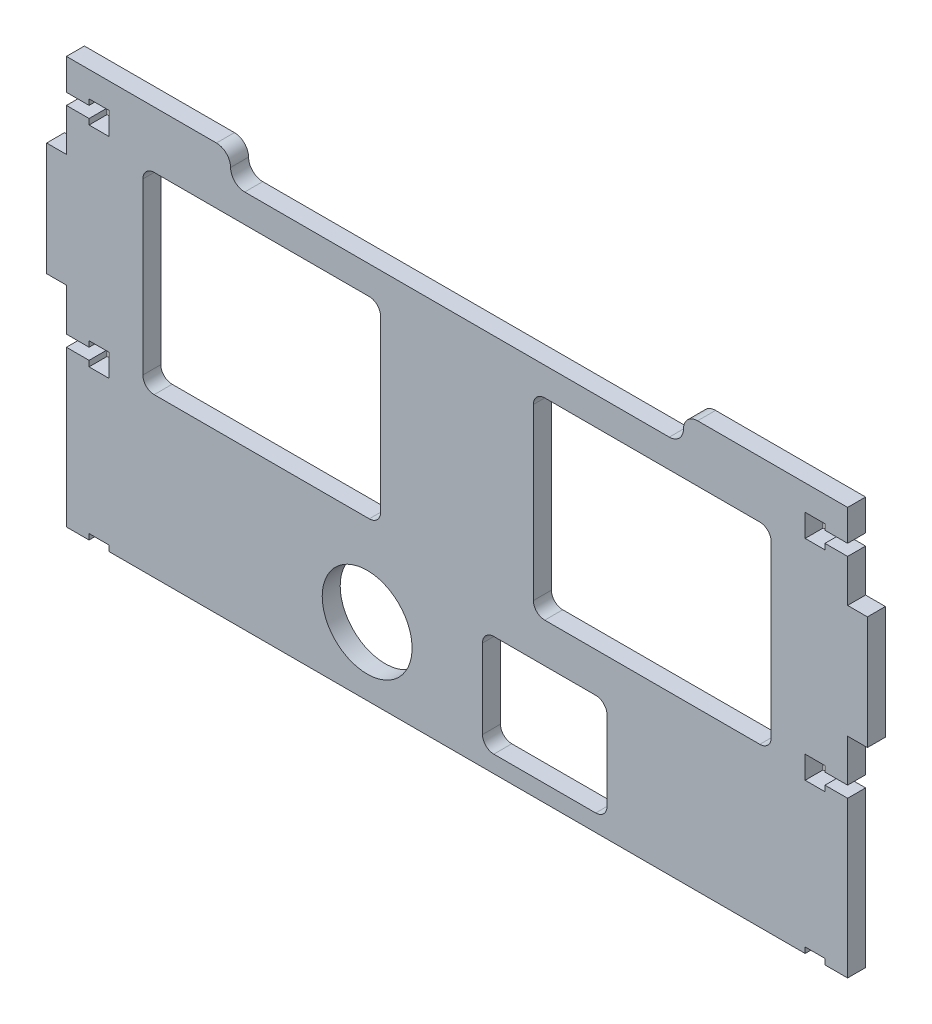
from build123d import *

# Parameters (mm, degrees)
BOSS_EXTRUDE1_DEPTH     = 3.175
CUT_EXTRUDE1_DEPTH      = 82.916607748
MIRROR2_COPY_1_DEPTH    = 82.916607748
SKETCH4_W               = 138
SKETCH4_H               = 9
BOSS_EXTRUDE3_DEPTH     = 3.175
CUT_EXTRUDE2_DEPTH      = 87.459994362
CUT_EXTRUDE2_DEPTH_BACK = 87.459994362
SKETCH5_W               = 80
SKETCH5_H               = 5
FILLET1_R               = 2.5
SKETCH6_W               = 3.5
SKETCH6_H               = 1
CUT_EXTRUDE3_DEPTH      = 87.459994362
SKETCH10_W              = 42
SKETCH10_H              = 34
CUT_EXTRUDE4_DEPTH      = 87.459994362
FILLET2_R               = 2
FILLET2_OF_MIRROR4_R    = 2
SKETCH11_R              = 7.9375
CUT_EXTRUDE5_DEPTH      = 10
SKETCH12_W              = 22
SKETCH12_H              = 18
CUT_EXTRUDE6_DEPTH      = 10
FILLET3_R               = 2


with BuildPart() as part:
    # Sketch1 → Boss-Extrude1 (new body)
    with BuildSketch(Plane.XY):
        Polygon((-69, -10), (-69, -38), (69, -38), (69, -10), (72.5, -10), (72.5, 10), (69, 10), (69, 25), (-69, 25), (-69, 10), (-72.5, 10), (-72.5, -10), align=None)
    extrude(amount=-BOSS_EXTRUDE1_DEPTH)

    # Sketch2 → Cut-Extrude1 (cut, symmetric)
    with BuildSketch(Plane.XY):
        Polygon((-69, 19.5), (-65, 19.5), (-65, 20.5), (-61.5, 20.5), (-61.5, 16.5), (-65, 16.5), (-65, 17.5), (-69, 17.5), align=None)
    cut_extrude1 = extrude(amount=CUT_EXTRUDE1_DEPTH, both=True, mode=Mode.SUBTRACT)

    # Mirror1: Cut-Extrude1 across plane
    add(cut_extrude1.mirror(Plane.ZY), mode=Mode.SUBTRACT)

    # Mirror2: Cut-Extrude1 across plane
    add(cut_extrude1.mirror(Plane.ZX), mode=Mode.SUBTRACT)

    # Mirror2 copy 1 sketch → Mirror2 copy 1 (cut, symmetric)
    with BuildSketch(Plane(origin=(0, 0, 0), x_dir=(-1, 0, 0), z_dir=(0, 0, 1))):
        Polygon((-69, 19.5), (-65, 19.5), (-65, 20.5), (-61.5, 20.5), (-61.5, 16.5), (-65, 16.5), (-65, 17.5), (-69, 17.5), align=None)
    extrude(amount=MIRROR2_COPY_1_DEPTH, both=True, mode=Mode.SUBTRACT)

    # Sketch4 → Boss-Extrude3 (add)
    with BuildSketch(Plane.XY):
        with Locations((0, -42.5)):
            Rectangle(SKETCH4_W, SKETCH4_H)
    extrude(amount=-BOSS_EXTRUDE3_DEPTH)

    # Sketch5 → Cut-Extrude2 (cut, two sides: drawn at the far end of the back side and taken through both)
    with BuildSketch(Plane.XY.offset(-CUT_EXTRUDE2_DEPTH_BACK)):
        with Locations((0, 22.5)):
            Rectangle(SKETCH5_W, SKETCH5_H)
    extrude(amount=CUT_EXTRUDE2_DEPTH + CUT_EXTRUDE2_DEPTH_BACK, mode=Mode.SUBTRACT)

    # Fillet1
    fillet1_edges = [part.edges().sort_by_distance(p)[0] for p in [
        (40, 20, -1.5875),
        (-40, 20, -1.5875),
    ]]
    fillet(fillet1_edges, radius=FILLET1_R)
    fillet1_2_edges = [part.edges().sort_by_distance(p)[0] for p in [
        (40, 25, -1.5875),
        (-40, 25, -1.5875),
    ]]
    fillet(fillet1_2_edges, radius=FILLET1_R - 0.0001)  # a hair under: the kernel refuses the full size

    # Sketch6 → Cut-Extrude3 (cut, symmetric)
    with BuildSketch(Plane.XY):
        with Locations((63.25, -46.5)):
            Rectangle(SKETCH6_W, SKETCH6_H)
    cut_extrude3 = extrude(amount=CUT_EXTRUDE3_DEPTH, both=True, mode=Mode.SUBTRACT)

    # Mirror3: Cut-Extrude3 across plane
    add(cut_extrude3.mirror(Plane.ZY), mode=Mode.SUBTRACT)

    # Sketch10 → Cut-Extrude4 (cut, through all)
    with BuildSketch(Plane(origin=(0, 0, -3.175), x_dir=(-1, 0, 0), z_dir=(0, 0, -1))):
        with Locations((34.5, -2)):
            Rectangle(SKETCH10_W, SKETCH10_H)
    cut_extrude4 = extrude(amount=-CUT_EXTRUDE4_DEPTH, mode=Mode.SUBTRACT)

    # Fillet2
    fillet2_edges = [part.edges().sort_by_distance(p)[0] for p in [
        (-55.5, 15, -1.5875),
        (-55.5, -19, -1.5875),
        (-13.5, -19, -1.5875),
        (-13.5, 15, -1.5875),
    ]]
    fillet(fillet2_edges, radius=FILLET2_R)

    # Mirror4: Cut-Extrude4 across plane
    add(cut_extrude4.mirror(Plane.ZY), mode=Mode.SUBTRACT)

    # Fillet2 of Mirror4
    fillet2_of_mirror4_edges = [part.edges().sort_by_distance(p)[0] for p in [
        (55.5, 15, -1.5875),
        (55.5, -19, -1.5875),
        (13.5, -19, -1.5875),
        (13.5, 15, -1.5875),
    ]]
    fillet(fillet2_of_mirror4_edges, radius=FILLET2_OF_MIRROR4_R)

    # Sketch11 → Cut-Extrude5 (cut)
    with BuildSketch(Plane(origin=(0, 0, -3.175), x_dir=(-1, 0, 0), z_dir=(0, 0, -1))):
        with Locations((15.875, -35)):
            Circle(SKETCH11_R)
    extrude(amount=-CUT_EXTRUDE5_DEPTH, mode=Mode.SUBTRACT)

    # Sketch12 → Cut-Extrude6 (cut)
    with BuildSketch(Plane(origin=(0, 0, -3.175), x_dir=(-1, 0, 0), z_dir=(0, 0, -1))):
        with Locations((-15.5, -35)):
            Rectangle(SKETCH12_W, SKETCH12_H)
    extrude(amount=-CUT_EXTRUDE6_DEPTH, mode=Mode.SUBTRACT)

    # Fillet3
    fillet3_edges = [part.edges().sort_by_distance(p)[0] for p in [
        (4.5, -26, -1.5875),
        (4.5, -44, -1.5875),
        (26.5, -44, -1.5875),
        (26.5, -26, -1.5875),
    ]]
    fillet(fillet3_edges, radius=FILLET3_R)


solid = part.part
